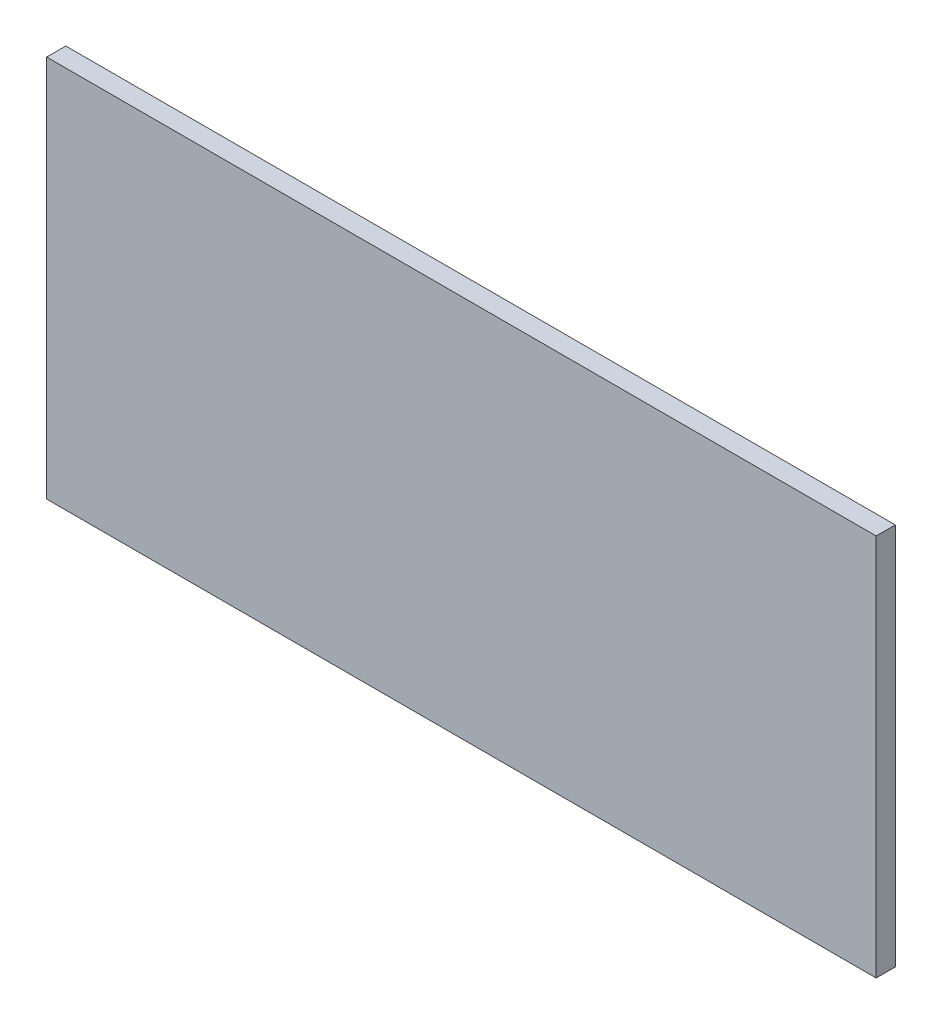
from build123d import *

# Parameters (mm, degrees)
SKETCH1_W           = 65
SKETCH1_H           = 30
BOSS_EXTRUDE1_DEPTH = 1.5
BOSS_EXTRUDE2_DEPTH = 1.5


with BuildPart() as part:
    # Sketch1 → Boss-Extrude1 (new body)
    with BuildSketch(Plane.XY):
        with Locations((103.27926781, 18.3614)):
            Rectangle(SKETCH1_W, SKETCH1_H)
    extrude(amount=-BOSS_EXTRUDE1_DEPTH)


with BuildPart() as body_2:
    # Sketch2 → Boss-Extrude2 (new body)
    with BuildSketch(Plane(origin=(0, 0, -1.5), x_dir=(-1, 0, 0), z_dir=(0, 0, -1))):
        with BuildLine():
            Line((-125.77926781, 27.8614), (-80.77926781, 27.8614))
            ThreePointArc((-80.77926781, 27.8614), (-79.011500857, 27.129166953), (-78.27926781, 25.3614))
            Line((-78.27926781, 25.3614), (-78.27926781, 11.3614))
            ThreePointArc((-78.27926781, 11.3614), (-79.011500857, 9.593633047), (-80.77926781, 8.8614))
            Line((-80.77926781, 8.8614), (-125.77926781, 8.8614))
            ThreePointArc((-125.77926781, 8.8614), (-127.547034763, 9.593633047), (-128.27926781, 11.3614))
            Line((-128.27926781, 11.3614), (-128.27926781, 25.3614))
            ThreePointArc((-128.27926781, 25.3614), (-127.547034763, 27.129166953), (-125.77926781, 27.8614))
        make_face()
    extrude(amount=BOSS_EXTRUDE2_DEPTH)


solid = Compound([part.part, body_2.part])
